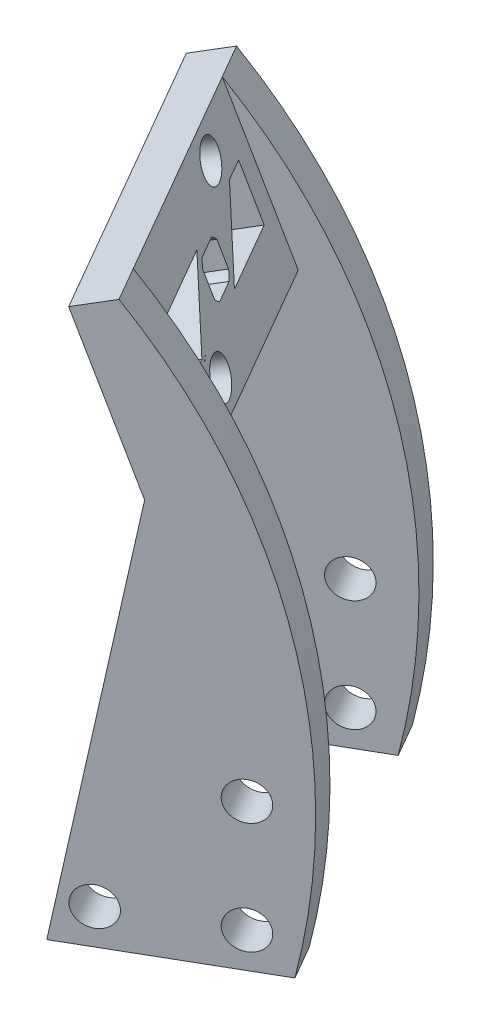
from build123d import *

# Parameters (mm, degrees)
BOSS_EXTRUDE1_OUTLINE_R = 2.15
BOSS_EXTRUDE1_DEPTH     = 4.45
BOSS_EXTRUDE2_START     = 1.2515
SKETCH2_R               = 2.15
BOSS_EXTRUDE2_DEPTH     = 4.45
BOSS_EXTRUDE3_DEPTH     = 1.251499962


# Read off the part's stored shape, not the designer's step: Boss-Extrude1
with BuildPart() as part:
    # Boss-Extrude1 outline → Boss-Extrude1 (new body)
    with BuildSketch(Plane(origin=(-50.959815044, -20.804257374, 29.421662933), x_dir=(-0.4364357804719844, -0.17817416127494956, -0.8819171036881971), z_dir=(0.8164965809277264, 0.3333333333333333, -0.4714045207910314))):
        Polygon((-19.487444888, 33.335644756), (5.258463865, 38.097997116), (1.667801371, 56.755626731), (-23.078107381, 51.993274371), align=None)
        with BuildLine():
            ThreePointArc((-14.857414364, 34.568841104), (-17.094425047, 37.205029513), (-15.59724376, 40.32146246))
            Line((-15.59724376, 40.32146246), (-15.535066644, 40.329458894))
            ThreePointArc((-15.535066644, 40.329458894), (-17.069629265, 37.208218432), (-14.795237248, 34.576837538))
            Line((-14.795237248, 34.576837538), (-14.857414364, 34.568841104))
        make_face(mode=Mode.SUBTRACT)
        with Locations((-13.94536077, 37.610022328)):
            Circle(BOSS_EXTRUDE1_OUTLINE_R, mode=Mode.SUBTRACT)
        Polygon((-11.370861729, 47.830728875), (-16.446050654, 40.336567322), (-19.205062219, 39.805595299), (-20.414548532, 46.090270538), align=None, mode=Mode.SUBTRACT)
        with BuildLine():
            Line((-10.795931949, 43.204869293), (-11.349147903, 46.079416754))
            ThreePointArc((-11.349147903, 46.079416754), (-11.103747968, 46.531394654), (-10.775137708, 46.927021304))
            Line((-10.775137708, 46.927021304), (-7.900590246, 47.480237259))
            ThreePointArc((-7.900590246, 47.480237259), (-7.448612347, 47.234837323), (-7.052985696, 46.906227063))
            Line((-7.052985696, 46.906227063), (-6.499769742, 44.031679602))
            ThreePointArc((-6.499769742, 44.031679602), (-6.745169677, 43.579701702), (-7.073779937, 43.184075051))
            Line((-7.073779937, 43.184075051), (-9.948327399, 42.630859097))
            ThreePointArc((-9.948327399, 42.630859097), (-10.400305299, 42.876259032), (-10.795931949, 43.204869293))
        make_face(mode=Mode.SUBTRACT)
        Polygon((-1.422691887, 49.745255053), (1.385418702, 50.285676188), (2.594905016, 44.00100095), (-6.497880812, 42.251093501), align=None, mode=Mode.SUBTRACT)
        with Locations((-3.874282746, 52.481249159)):
            Circle(BOSS_EXTRUDE1_OUTLINE_R, mode=Mode.SUBTRACT)
    extrude(amount=BOSS_EXTRUDE1_DEPTH)


with BuildPart() as body_2:
    # Sketch2 → Boss-Extrude2 (new body)
    with BuildSketch(Plane(origin=(-6.181776854, 0, -10.707151593), x_dir=(-0.866025403784439, 0, 0.4999999999999995), z_dir=(-0.49999999999999944, 0, -0.8660254037844389)).offset(BOSS_EXTRUDE2_START)):
        with BuildLine():
            Line((70.982570609, 13.530711728), (79.145309345, -31.347065587))
            Line((79.145309345, -31.347065587), (58.445309345, -31.347065587))
            ThreePointArc((58.445309345, -31.347065587), (58.677489694, 2.412466855), (73.120403707, 32.927416852))
            Line((73.120403707, 32.927416852), (77.315903942, 31.444083519))
            Line((77.315903942, 31.444083519), (70.982570609, 13.530711728))
        make_face()
        with Locations(Location((62.445309345, -27.347065587, 0), (0, 0, 180))):
            Circle(SKETCH2_R, mode=Mode.SUBTRACT)
        with Locations(Location((62.445309345, -14.647065587, 0), (0, 0, 180))):
            Circle(SKETCH2_R, mode=Mode.SUBTRACT)
        with Locations(Location((75.145309345, -27.347065587, 0), (0, 0, 180))):
            Circle(SKETCH2_R, mode=Mode.SUBTRACT)
    extrude(amount=BOSS_EXTRUDE2_DEPTH)


with BuildPart() as body_3:
    # Sketch4 → Boss-Extrude3 (new body)
    with BuildSketch(Plane(origin=(-6.181776854, 0, -10.707151593), x_dir=(-0.866025403784439, 0, 0.4999999999999995), z_dir=(-0.49999999999999944, 0, -0.8660254037844389))):
        Polygon((70.982570609, 13.530711728), (77.315903942, 31.444083519), (73.120403707, 32.927416852), (66.787070374, 15.014045062), align=None)
    extrude(amount=BOSS_EXTRUDE3_DEPTH)


with BuildPart() as body_4:
    # Mirror1: mirrored copy
    add(body_2.part.mirror(Plane(origin=(0.118223146, 0, 0.204768495), x_dir=(-0.8660254037844389, 0, 0.49999999999999967), z_dir=(0.49999999999999944, 0, 0.8660254037844389))))


with BuildPart() as body_5:
    # Mirror1 2: mirrored copy
    add(body_3.part.mirror(Plane(origin=(0.118223146, 0, 0.204768495), x_dir=(-0.8660254037844389, 0, 0.49999999999999967), z_dir=(0.49999999999999944, 0, 0.8660254037844389))))


with BuildPart() as body_2_1:
    add(body_2.part)

    # Combine1: union body 3, body 4, body 5, part
    add(body_3.part)
    add(body_4.part)
    add(body_5.part)
    add(part.part)


solid = body_2_1.part
